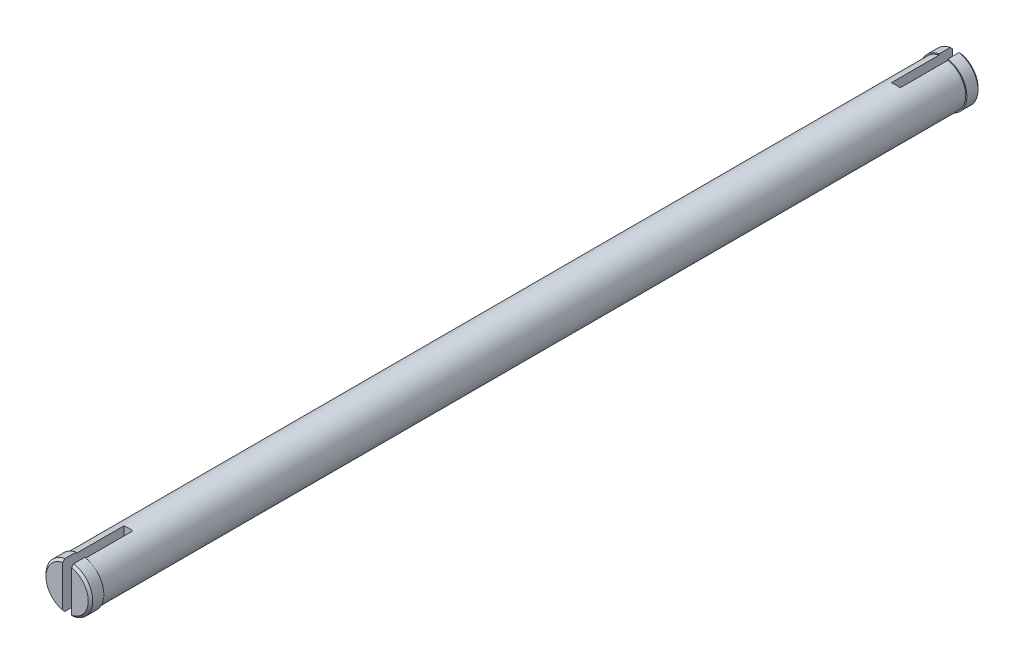
from build123d import *

# Parameters (mm, degrees)
SKETCH_1_R          = 2
EXTRUDE_1_DEPTH     = 40
SKETCH_2_R          = 2.1
EXTRUDE_2_DEPTH     = 1.2
CHAMFER_1_SIZE      = 0.2
SKETCH_3_W          = 0.8
SKETCH_3_H          = 4.5
CUT_EXTRUDE_1_DEPTH = 5.5


# Read off the part's stored shape, not the designer's step: 镜向1
with BuildPart() as part:
    # 草图1 → 凸台-拉伸1 (new body)
    with BuildSketch(Plane.XY):
        Circle(SKETCH_1_R)
    extrude(amount=EXTRUDE_1_DEPTH)

    # 草图2 → 凸台-拉伸2 (add)
    with BuildSketch(Plane.XY.offset(40)):
        Circle(SKETCH_2_R)
    extrude(amount=-EXTRUDE_2_DEPTH)

    # 倒角1
    chamfer_1_edges = [part.edges().sort_by_distance(p)[0] for p in [
        (-2.1, 0, 40),
    ]]
    chamfer(chamfer_1_edges, length=CHAMFER_1_SIZE)

    # 草图3 → 切除-拉伸1 (cut)
    with BuildSketch(Plane.XY.offset(40)):
        Rectangle(SKETCH_3_W, SKETCH_3_H)
    extrude(amount=-CUT_EXTRUDE_1_DEPTH, mode=Mode.SUBTRACT)

    # 镜向1: part across plane


with BuildPart() as part_1:
    add(part.part)
    add(part.part.mirror(Plane.XY))


solid = part_1.part
